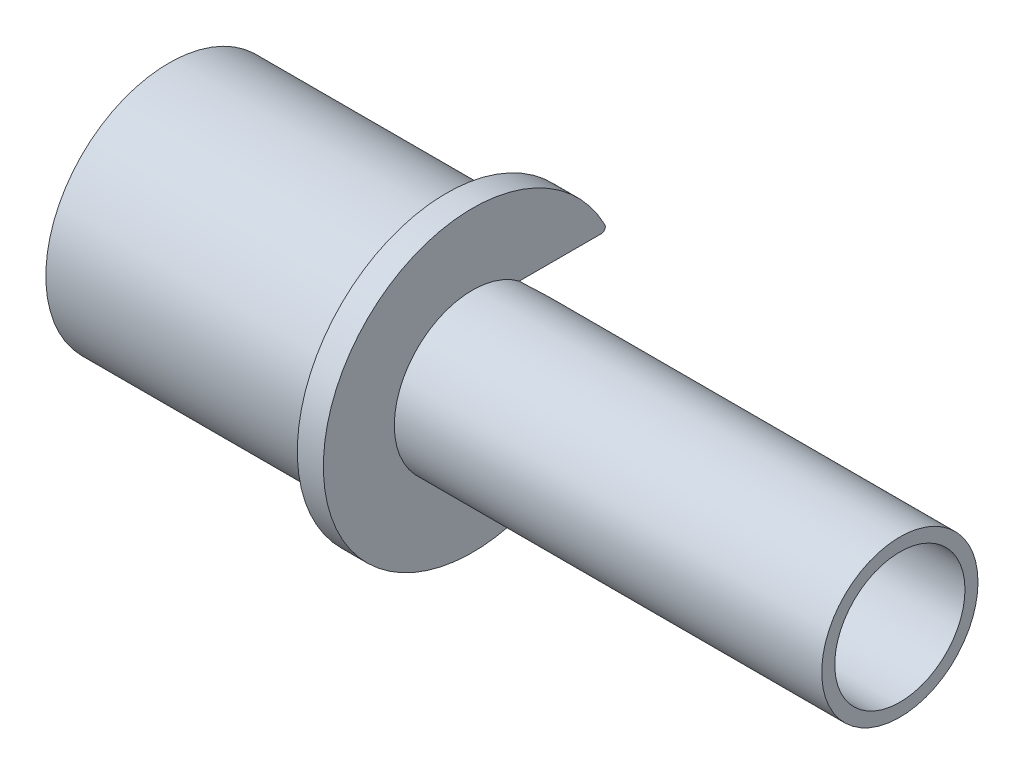
from build123d import *

# Parameters (mm, degrees)
CUT_EXTRUDE2_REACH = 52.333
FILLET1_R          = 0.254


with BuildPart() as part:
    # Sketch1 → Revolve1 (revolve)
    with BuildSketch(Plane.XY):
        Polygon((-4.1125, 3.96875), (-4.1125, 4.7625), (-30.1625, 4.7625), (-30.1625, 9.087499986), (-31.75, 9.087499986), (-31.75, 7.499999986), (-48.664999952, 7.499999986), (-48.664999952, 3.96875), align=None)
    revolve(axis=Axis((0, 0, 0), (-1, 0, 0)))

    # Sketch3 → Cut-Extrude2 (cut, up to next)
    with BuildSketch(Plane.XY, mode=Mode.PRIVATE) as cut_extrude2_sk1:
        with BuildLine():
            Line((-48.664999952, 3.81), (-48.664999952, -3.81))
            Line((-48.664999952, -3.81), (-30.1625, -3.81))
            ThreePointArc((-30.1625, -3.81), (-27.91743597, -2.88006403), (-26.9875, -0.635))
            Line((-26.9875, -0.635), (-26.9875, 0.635))
            ThreePointArc((-26.9875, 0.635), (-27.91743597, 2.88006403), (-30.1625, 3.81))
            Line((-30.1625, 3.81), (-48.664999952, 3.81))
        make_face()
    cut_extrude2_tool1 = extrude(cut_extrude2_sk1.sketch, amount=-CUT_EXTRUDE2_REACH, mode=Mode.PRIVATE) & part.part
    add(cut_extrude2_tool1.solids().sort_by_distance((-38.098711, 0, 0))[0], mode=Mode.SUBTRACT)

    # Fillet1
    fillet1_edges = [part.edges().sort_by_distance(p)[0] for p in [
        (-30.95625, 3.81, -8.250245814),
        (-30.95625, -3.81, -8.250245814),
        (-40.207499976, -3.81, -6.460178),
        (-40.207499976, 3.81, -6.460178),
    ]]
    fillet(fillet1_edges, radius=FILLET1_R)


solid = part.part
